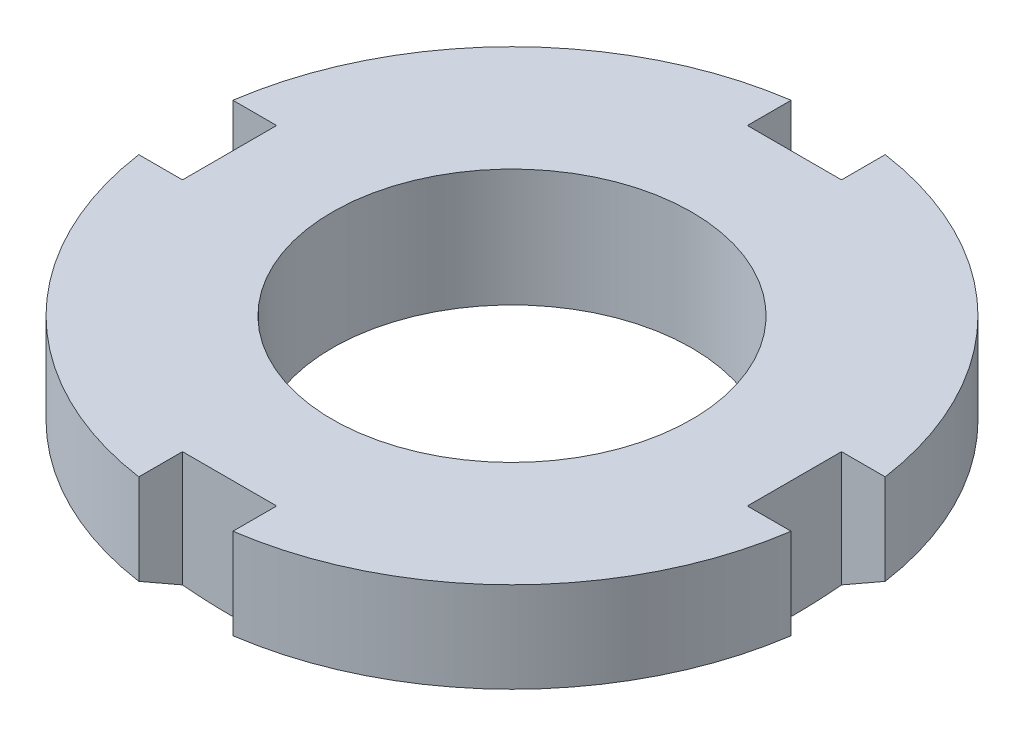
from build123d import *

# Parameters (mm, degrees)
ESQUISSE2_W    = 4
ESQUISSE2_H    = 2
ESQUISSE2_W_2  = 2
ESQUISSE2_H_2  = 4
ENCOCHES_DEPTH = 24.34523506


with BuildPart() as part:
    # Esquisse1 → Base (revolve)
    with BuildSketch(Plane.XY):
        Polygon((7.633974596, 5), (14, 5), (14, 1.154700538), (12, 0), (7.633974596, 0), align=None)
    revolve(axis=Axis((0, 0, 0), (0, 1, 0)))

    # Esquisse2 → Encoches (cut, through all)
    with BuildSketch(Plane(origin=(0, 5, -4), x_dir=(1, 0, 0), z_dir=(0, -1, 0))):
        with Locations((0, -9)):
            Rectangle(ESQUISSE2_W, ESQUISSE2_H)
        with Locations((0, 17)):
            Rectangle(ESQUISSE2_W, ESQUISSE2_H)
        with Locations((13, 4)):
            Rectangle(ESQUISSE2_W_2, ESQUISSE2_H_2)
        with Locations((-13, 4)):
            Rectangle(ESQUISSE2_W_2, ESQUISSE2_H_2)
    extrude(amount=ENCOCHES_DEPTH, mode=Mode.SUBTRACT)


solid = part.part
